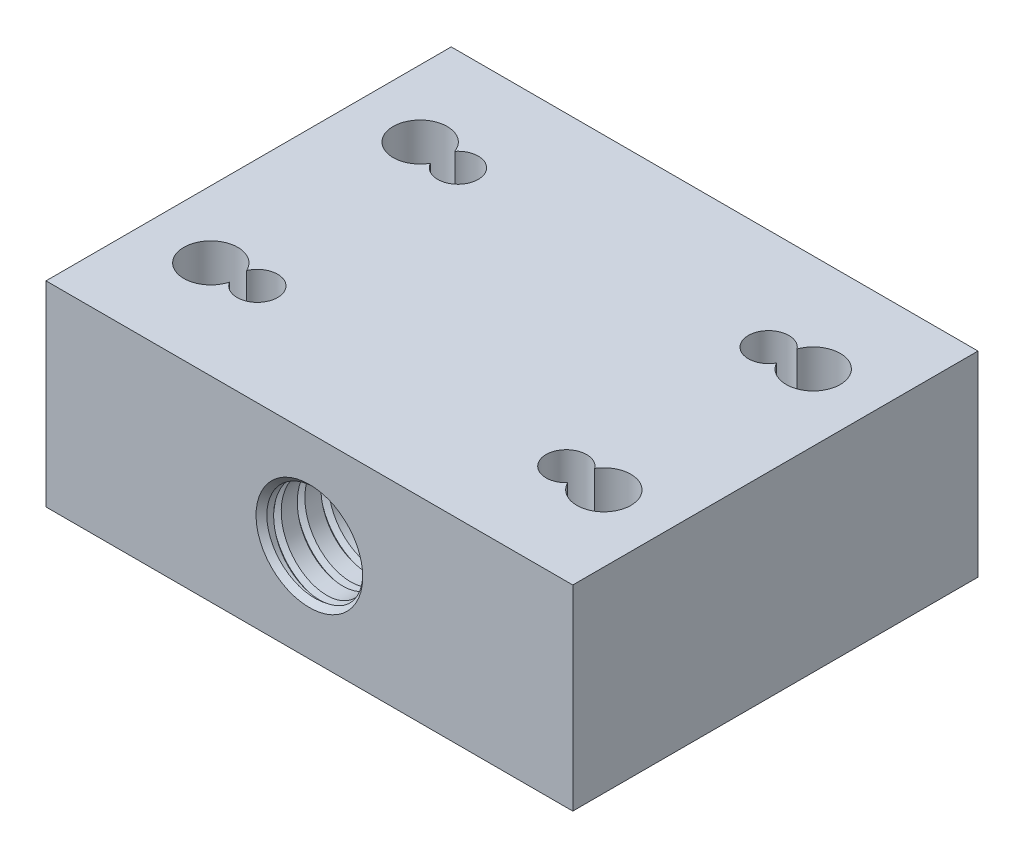
from build123d import *

# Parameters (mm, degrees)
SKETCH2_W           = 78
SKETCH2_H           = 60
BOSS_EXTRUDE2_DEPTH = 29
SKETCH4_R           = 7.1
CUT_EXTRUDE1_DEPTH  = 78.21398837
CHAMFER1_SIZE       = 0.8
SKETCH8_R           = 3
CUT_EXTRUDE2_DEPTH  = 20
THREAD1_PITCH       = 3.5
SKETCH3_R           = 4
CUT_EXTRUDE3_DEPTH  = 30


with BuildPart() as part:
    # Sketch2 → Boss-Extrude2 (new body)
    with BuildSketch(Plane(origin=(0, 0, 0), x_dir=(1, 0, 0), z_dir=(0, 1, 0))):
        Rectangle(SKETCH2_W, SKETCH2_H)
    extrude(amount=BOSS_EXTRUDE2_DEPTH)

    # Sketch4 → Cut-Extrude1 (cut, through all)
    with BuildSketch(Plane.XY.offset(30)):
        with Locations((0, 14.5)):
            Circle(SKETCH4_R)
    extrude(amount=-CUT_EXTRUDE1_DEPTH, mode=Mode.SUBTRACT)

    # Chamfer1
    chamfer1_edges = [part.edges().sort_by_distance(p)[0] for p in [
        (-7.1, 14.5, -30),
        (-7.1, 14.5, 30),
    ]]
    chamfer(chamfer1_edges, length=CHAMFER1_SIZE)

    # Sketch8 → Cut-Extrude2 (cut)
    with BuildSketch(Plane(origin=(0, 29, 0), x_dir=(1, 0, 0), z_dir=(0, 1, 0))):
        with Locations(Location((-23, 15, 0), (0, 0, 270))):
            Circle(SKETCH8_R)
        with Locations(Location((23, 15, 0), (0, 0, 270))):
            Circle(SKETCH8_R)
        with Locations(Location((23.292350502, -15.249805847, 0), (0, 0, 270))):
            Circle(SKETCH8_R)
        with Locations(Location((-22.707649498, -15, 0), (0, 0, 270))):
            Circle(SKETCH8_R)
    extrude(amount=-CUT_EXTRUDE2_DEPTH, mode=Mode.SUBTRACT)

    # Thread1: arcs per turn and ends read off the stored shape
    # Thread1: the profile of Thread Profile2 profile screwed along a right-hand helix through 18.914286 turns, 12 arcs to a turn; built about Z, then put on its axis
    thread1_z = Axis((0, 0, 0), (0, 0, 1))
    thread1_corners = [(7.0997, 0, -0.000173205), (7.911898813, 0, 0.468749998), (7.911898813, 0, 0.656249998), (7.0997, 0, 1.125173201)]
    with BuildLine(mode=Mode.PRIVATE) as thread1_profile:
        Line(thread1_corners[0], thread1_corners[1])
        Line(thread1_corners[1], thread1_corners[2])
        Line(thread1_corners[2], thread1_corners[3])
        Line(thread1_corners[3], thread1_corners[0])
    thread1_cap = Face(thread1_profile.wire())
    thread1_turn_angles = [0, 15, 30, 45, 60, 75, 90, 105, 120, 135, 150, 165, 180, 195, 210, 225, 240, 255, 270, 285, 300, 315, 330, 345, 360]
    thread1_turn_weights = [1, 0.9659258262890683, 1, 0.9659258262890683, 1, 0.9659258262890683, 1, 0.9659258262890683, 1, 0.9659258262890683, 1, 0.9659258262890683, 1, 0.9659258262890683, 1, 0.9659258262890683, 1, 0.9659258262890683, 1, 0.9659258262890683, 1, 0.9659258262890683, 1, 0.9659258262890683, 1]
    thread1_turn_rails = [Edge.make_bspline([Vector(p[0], p[1], 0).rotate(thread1_z, thread1_turn_angles[k]) / thread1_turn_weights[k] + Vector(0, 0, p[2] + THREAD1_PITCH * thread1_turn_angles[k] / 360) for k in range(25)], [0, 0, 0, 1, 1, 2, 2, 3, 3, 4, 4, 5, 5, 6, 6, 7, 7, 8, 8, 9, 9, 10, 10, 11, 11, 12, 12, 12], 2, thread1_turn_weights) for p in thread1_corners]
    thread1_turn_sides = [Face.make_surface_from_curves(thread1_turn_rails[p[0]], thread1_turn_rails[p[1]]) for p in [(0, 1), (1, 2), (2, 3), (3, 0)]]
    thread1_last_angles = [6480, 6495, 6510, 6525, 6540, 6555, 6570, 6585, 6600, 6615, 6630, 6645, 6660, 6675, 6690, 6705, 6720, 6735, 6750, 6765, 6780, 6794.5715, 6809.143]
    thread1_last_weights = [1, 0.9659258262890683, 1, 0.9659258262890683, 1, 0.9659258262890683, 1, 0.9659258262890683, 1, 0.9659258262890683, 1, 0.9659258262890683, 1, 0.9659258262890683, 1, 0.9659258262890683, 1, 0.9659258262890683, 1, 0.9659258262890683, 1, 0.9678344348058157, 1]
    thread1_last_rails = [Edge.make_bspline([Vector(p[0], p[1], 0).rotate(thread1_z, thread1_last_angles[k]) / thread1_last_weights[k] + Vector(0, 0, p[2] + THREAD1_PITCH * thread1_last_angles[k] / 360) for k in range(23)], [0, 0, 0, 1, 1, 2, 2, 3, 3, 4, 4, 5, 5, 6, 6, 7, 7, 8, 8, 9, 9, 10, 10, 11, 11, 11], 2, thread1_last_weights) for p in thread1_corners]
    thread1_last_sides = [Face.make_surface_from_curves(thread1_last_rails[p[0]], thread1_last_rails[p[1]]) for p in [(0, 1), (1, 2), (2, 3), (3, 0)]]
    thread1 = Plane(origin=(0, 14.5, -34.2), x_dir=(1, 0, 0), z_dir=(0, 0, 1)) * Solid(Shell([*[p.moved(Location((0, 0, THREAD1_PITCH * i))) for i in range(18) for p in thread1_turn_sides], *thread1_last_sides, thread1_cap, thread1_cap.rotate(thread1_z, 6809.143).moved(Location((0, 0, THREAD1_PITCH * 6809.143 / 360)))]))
    add(thread1, mode=Mode.SUBTRACT)

    # Sketch3 → Cut-Extrude3 (cut)
    with BuildSketch(Plane.XZ):
        with Locations(Location((-29.1, -15.5, 0), (0, 0, 270))):
            Circle(SKETCH3_R)
        with Locations(Location((-29.1, 15.5, 0), (0, 0, 270))):
            Circle(SKETCH3_R)
        with Locations(Location((29.1, 15.5, 0), (0, 0, 270))):
            Circle(SKETCH3_R)
        with Locations(Location((29.1, -15.5, 0), (0, 0, 270))):
            Circle(SKETCH3_R)
    extrude(amount=-CUT_EXTRUDE3_DEPTH, mode=Mode.SUBTRACT)


solid = part.part
